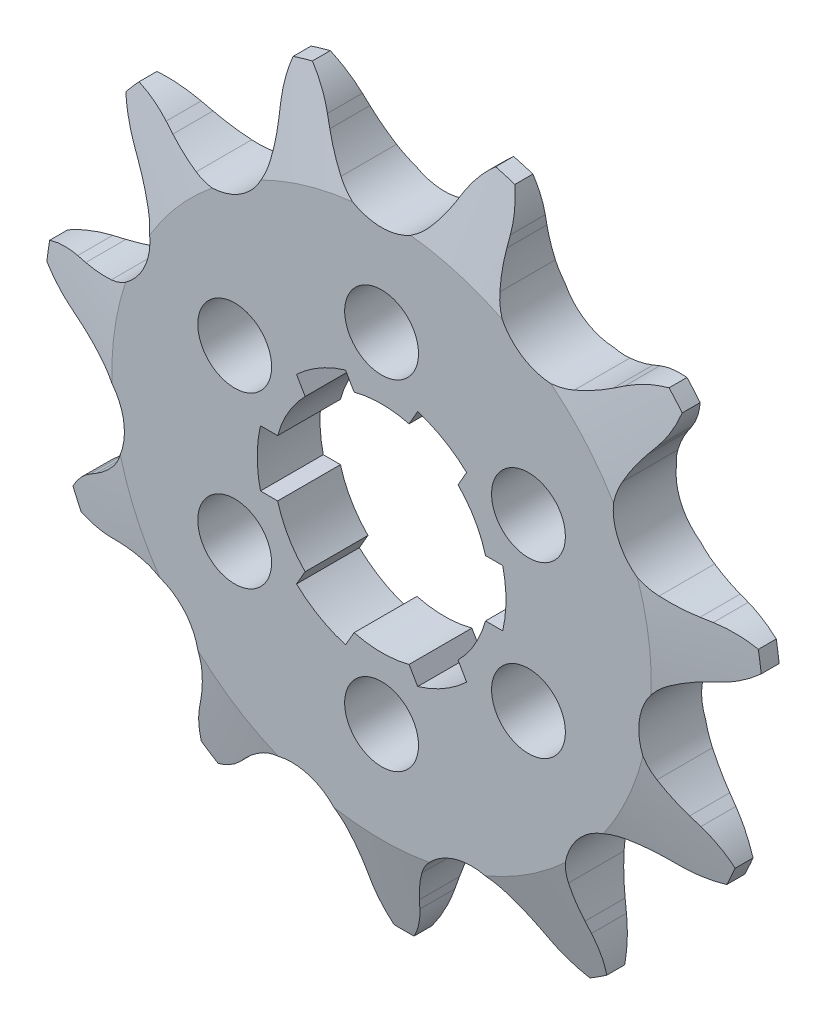
from build123d import *

# Parameters (mm, degrees)
CUT_EXTRUDE1_DEPTH      = 46.050861773
CIRPATTERN1_COUNT       = 11
CUT_EXTRUDE2_DEPTH      = 45.903287026
CUT_EXTRUDE2_DEPTH_BACK = 45.903287026
SKETCH3_OUTSIDE_W       = 82.986
SKETCH3_OUTSIDE_H       = 82.355
SKETCH3_OUTSIDE_R       = 36.957
SKETCH3_OUTSIDE_R_2     = 8.5
CUT_EXTRUDE4_DEPTH      = 46.160371144
SKETCH15_R              = 3.2639
CUT_EXTRUDE5_DEPTH      = 46.160371144
CUT_EXTRUDE6_DEPTH      = 45.903403069
CUT_EXTRUDE6_DEPTH_BACK = 45.903403069
SKETCH16_R              = 9.525


with BuildPart() as part:
    # Sketch1 → Revolve1 (revolve)
    with BuildSketch(Plane(origin=(0, 0, 0), x_dir=(0, 0, -1), z_dir=(1, 0, 0))):
        Polygon((2.778125, 0), (-2.778125, 0), (-2.778125, 23.857642459), (-0.79375, 31.795142459), (0.79375, 31.795142459), (2.778125, 23.857642459), align=None)
    revolve(axis=Axis((0, 0, -2.778125), (0, 0, 1)))

    # Sketch0 → Cut-Extrude1 (cut, symmetric)
    with BuildSketch(Plane.XY):
        with BuildLine():
            Line((13.704056458, -25.310310757), (13.050398427, -24.631275233))
            ThreePointArc((13.050398427, -24.631275233), (11.95512537, -23.614779328), (10.752525531, -22.727851696))
            ThreePointArc((10.752525531, -22.727851696), (6.488408594, -22.097490349), (3.24200423, -24.933139726))
            ThreePointArc((3.24200423, -24.933139726), (2.709822147, -26.329445289), (2.337978996, -27.776725382))
            Line((2.337978996, -27.776725382), (2.155201188, -28.701360627))
            ThreePointArc((2.155201188, -28.701360627), (-1.617083023, -34.260607897), (-8.235613288, -35.414044291))
            ThreePointArc((-8.235613288, -35.414044291), (10.243525573, -34.886244325), (26.074516628, -25.339681171))
            ThreePointArc((26.074516628, -25.339681171), (19.883059866, -27.947596343), (13.704056458, -25.310310757))
        make_face()
    cut_extrude1 = extrude(amount=CUT_EXTRUDE1_DEPTH, both=True, mode=Mode.SUBTRACT)

    # CirPattern1: Cut-Extrude1 ×11 about axis
    cirpattern1_axis = Axis((0, 0, -2.778125), (0, 0, -1))
    for i in range(1, CIRPATTERN1_COUNT):
        add(cut_extrude1.rotate(cirpattern1_axis, i * 360 / CIRPATTERN1_COUNT), mode=Mode.SUBTRACT)

    # Sketch3 outside → Cut-Extrude2 (cut, two sides: drawn at the far end of the back side and taken through both)
    # profile 1 of 2: a face of its own
    with BuildSketch(Plane.XY.offset(-CUT_EXTRUDE2_DEPTH_BACK)):
        with Locations((0, -0.5245)):
            Rectangle(SKETCH3_OUTSIDE_W, SKETCH3_OUTSIDE_H)
        Circle(SKETCH3_OUTSIDE_R, mode=Mode.SUBTRACT)
    # profile 2 of 2: a face of its own
    with BuildSketch(Plane.XY.offset(-CUT_EXTRUDE2_DEPTH_BACK)):
        Circle(SKETCH3_OUTSIDE_R_2)
    extrude(amount=CUT_EXTRUDE2_DEPTH + CUT_EXTRUDE2_DEPTH_BACK, mode=Mode.SUBTRACT)

    # Sketch12 → Cut-Extrude4 (cut, through all)
    with BuildSketch(Plane(origin=(0, 0, -2.778125), x_dir=(-1, 0, 0), z_dir=(0, 0, -1))):
        with BuildLine():
            Line((10.712142643, 2.5), (8.645808233, 2.5))
            ThreePointArc((8.645808233, 2.5), (7.794228634, 4.5), (6.487967626, 6.237489566))
            Line((6.487967626, 6.237489566), (7.521134831, 8.026987658))
            ThreePointArc((7.521134831, 8.026987658), (5.5, 9.526279442), (3.191007812, 10.526987658))
            Line((3.191007812, 10.526987658), (2.157840607, 8.737489566))
            ThreePointArc((2.157840607, 8.737489566), (0, 9), (-2.157840607, 8.737489566))
            Line((-2.157840607, 8.737489566), (-3.191007812, 10.526987658))
            ThreePointArc((-3.191007812, 10.526987658), (-5.5, 9.526279442), (-7.521134831, 8.026987658))
            Line((-7.521134831, 8.026987658), (-6.487967626, 6.237489566))
            ThreePointArc((-6.487967626, 6.237489566), (-7.794228634, 4.5), (-8.645808233, 2.5))
            Line((-8.645808233, 2.5), (-10.712142643, 2.5))
            ThreePointArc((-10.712142643, 2.5), (-11, 0), (-10.712142643, -2.5))
            Line((-10.712142643, -2.5), (-8.645808233, -2.5))
            ThreePointArc((-8.645808233, -2.5), (-7.794228634, -4.5), (-6.487967626, -6.237489566))
            Line((-6.487967626, -6.237489566), (-7.521134831, -8.026987658))
            ThreePointArc((-7.521134831, -8.026987658), (-5.5, -9.526279442), (-3.191007812, -10.526987658))
            Line((-3.191007812, -10.526987658), (-2.157840607, -8.737489566))
            ThreePointArc((-2.157840607, -8.737489566), (0, -9), (2.157840607, -8.737489566))
            Line((2.157840607, -8.737489566), (3.191007812, -10.526987658))
            ThreePointArc((3.191007812, -10.526987658), (5.5, -9.526279442), (7.521134831, -8.026987658))
            Line((7.521134831, -8.026987658), (6.487967626, -6.237489566))
            ThreePointArc((6.487967626, -6.237489566), (7.794228634, -4.5), (8.645808233, -2.5))
            Line((8.645808233, -2.5), (10.712142643, -2.5))
            ThreePointArc((10.712142643, -2.5), (11, 0), (10.712142643, 2.5))
        make_face()
    extrude(amount=-CUT_EXTRUDE4_DEPTH, mode=Mode.SUBTRACT)

    # Sketch15 → Cut-Extrude5 (cut, through all)
    with BuildSketch(Plane.XY.offset(2.778125)):
        with Locations((0, 15)):
            Circle(SKETCH15_R)
        with Locations((12.990381057, 7.5)):
            Circle(SKETCH15_R)
        with Locations((12.990381057, -7.5)):
            Circle(SKETCH15_R)
        with Locations((0, -15)):
            Circle(SKETCH15_R)
        with Locations((-12.990381057, -7.5)):
            Circle(SKETCH15_R)
        with Locations((-12.990381057, 7.5)):
            Circle(SKETCH15_R)
    extrude(amount=-CUT_EXTRUDE5_DEPTH, mode=Mode.SUBTRACT)

    # Sketch16 → Cut-Extrude6 (cut, two sides: drawn at the far end of the back side and taken through both)
    with BuildSketch(Plane.XY.offset(-0.001875).offset(-CUT_EXTRUDE6_DEPTH_BACK)):
        Circle(SKETCH16_R)
    extrude(amount=CUT_EXTRUDE6_DEPTH + CUT_EXTRUDE6_DEPTH_BACK, mode=Mode.SUBTRACT)


solid = part.part
